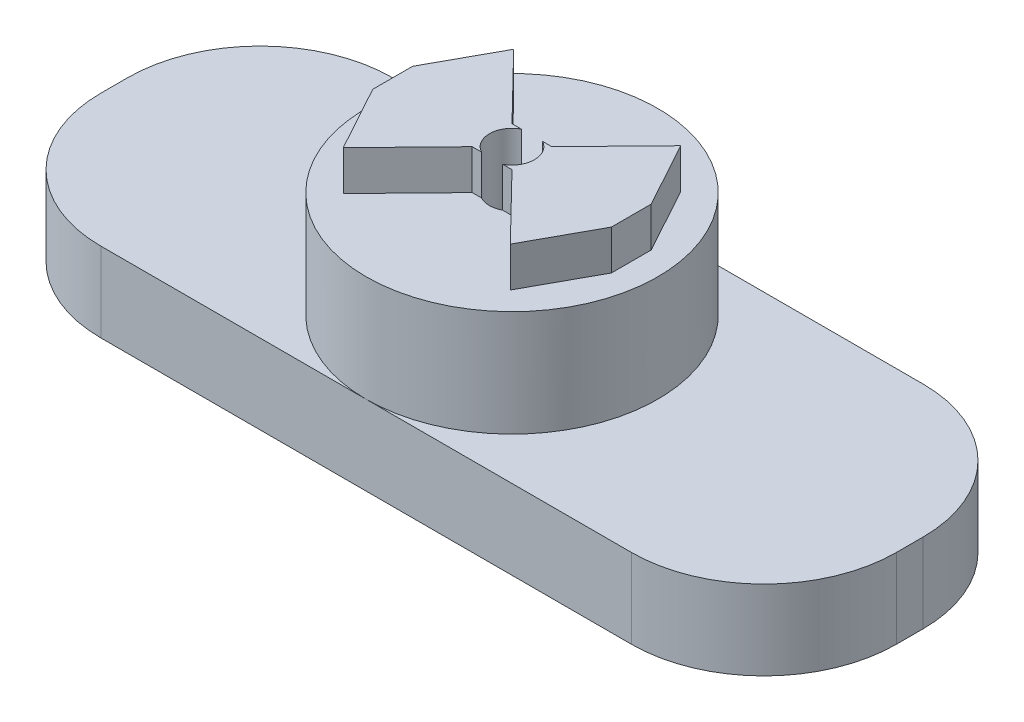
from build123d import *

# Parameters (mm, degrees)
BOSS_EXTRUDE1_DEPTH                                 = 6
SKETCH2_R                                           = 11
BOSS_EXTRUDE2_DEPTH                                 = 8
SKETCH12_R                                          = 6
CUT_EXTRUDE2_DEPTH                                  = 4
BOSS_EXTRUDE3_DEPTH                                 = 3
CSK_FOR_M3_COUNTERSUNK_FLAT_HEAD_SCREW3_D           = 3.4
CSK_FOR_M3_COUNTERSUNK_FLAT_HEAD_SCREW3_CSINK_D     = 6.3
CSK_FOR_M3_COUNTERSUNK_FLAT_HEAD_SCREW3_CSINK_ANGLE = 90


with BuildPart() as part:
    # Sketch1 → Boss-Extrude1 (new body)
    with BuildSketch(Plane(origin=(0, 0, 0), x_dir=(1, 0, 0), z_dir=(0, 1, 0))):
        with BuildLine():
            Line((-20.01, -11), (20.01, -11))
            ThreePointArc((20.01, -11), (27.073996744, -8.073996744), (30, -1.01))
            Line((30, -1.01), (30, 1.01))
            ThreePointArc((30, 1.01), (27.073996744, 8.073996744), (20.01, 11))
            Line((20.01, 11), (-20.01, 11))
            ThreePointArc((-20.01, 11), (-27.073996744, 8.073996744), (-30, 1.01))
            Line((-30, 1.01), (-30, -1.01))
            ThreePointArc((-30, -1.01), (-27.073996744, -8.073996744), (-20.01, -11))
        make_face()
    extrude(amount=BOSS_EXTRUDE1_DEPTH)

    # Sketch2 → Boss-Extrude2 (add)
    with BuildSketch(Plane(origin=(0, 6, 0), x_dir=(1, 0, 0), z_dir=(0, 1, 0))):
        Circle(SKETCH2_R)
    extrude(amount=BOSS_EXTRUDE2_DEPTH)

    # Sketch12 → Cut-Extrude2 (cut)
    with BuildSketch(Plane.XZ):
        Circle(SKETCH12_R)
    extrude(amount=-CUT_EXTRUDE2_DEPTH, mode=Mode.SUBTRACT)

    # Sketch19 → Boss-Extrude3 (add)
    with BuildSketch(Plane(origin=(0, 14, 0), x_dir=(1, 0, 0), z_dir=(0, 1, 0))):
        Polygon((-6.300393599, 6.426899758), (-9, 1.5), (-9, -1.5), (-6.300393599, -6.426899758), (-1.5, -1.5), (1.5, -1.5), (6.300393599, -6.426899758), (9, -1.5), (9, 1.5), (6.300393599, 6.426899758), (1.5, 1.5), (-1.5, 1.5), align=None)
    extrude(amount=BOSS_EXTRUDE3_DEPTH)

    # CSK for M3 Countersunk Flat Head Screw3 (through all)
    with Locations(Plane(origin=(0, 4, 0), x_dir=(-1, 0, 0), z_dir=(0, -1, 0))):
        with Locations((0, 0)):
            CounterSinkHole(CSK_FOR_M3_COUNTERSUNK_FLAT_HEAD_SCREW3_D / 2, CSK_FOR_M3_COUNTERSUNK_FLAT_HEAD_SCREW3_CSINK_D / 2, counter_sink_angle=CSK_FOR_M3_COUNTERSUNK_FLAT_HEAD_SCREW3_CSINK_ANGLE)


solid = part.part
